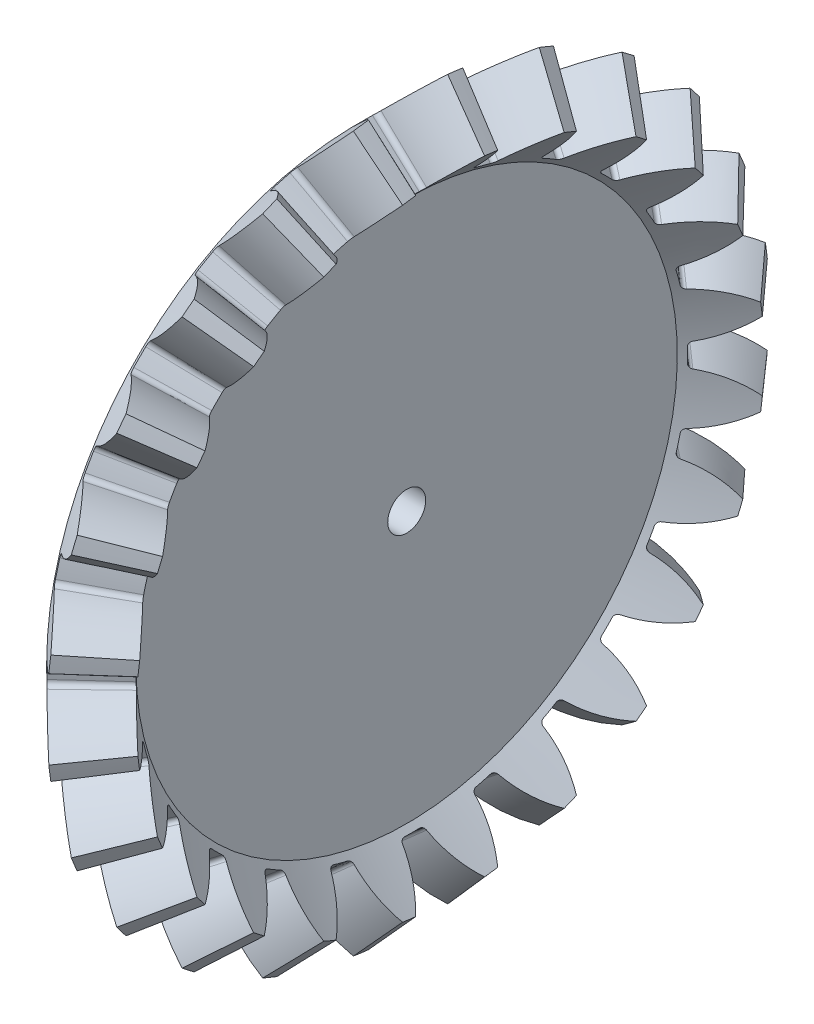
from build123d import *

# Parameters (mm, degrees)
TOOCUTSKE2_R    = 0.0127
TEETHCUTS_COUNT = 24
TEETHCUTS_ANGLE = 345
HUBSKE_R        = 5
HUB_DEPTH       = 0.0001016
BORSKE_R        = 1.5
BORE_DEPTH      = 29.363555216


with BuildPart() as part:
    # BasProSke → Base-Revolve (revolve)
    with BuildSketch(Plane(origin=(0, 0, 0), x_dir=(1, 0, 0), z_dir=(0, 1, 0))):
        Polygon((0, 0), (0, 24.636495586), (3.954494677, 28.590990256), (7.281695246, 24.847123014), (3.845024644, 21.410452418), (3.845024644, 0), align=None)
    revolve(axis=Axis((-10, 0, 0), (1, 0, 0)))

    # TooCutSke2 → ToothCut section 0
    with BuildSketch(Plane(origin=(14.681752183, -14.681752209, 0), x_dir=(0, 0, 1), z_dir=(-0.7071067805519597, 0.7071067818211354, 0))):
        with Locations((0, 20.763133078)):
            Circle(TOOCUTSKE2_R)
    # TooCutSke → ToothCut section 1
    with BuildSketch(Plane(origin=(1.977247339, 26.613742921, 0), x_dir=(0, 0, -1), z_dir=(-0.70710678055196, 0.7071067818211351, 0))):
        with BuildLine():
            ThreePointArc((-3.543432931, -3.170080071), (0, -3.38125), (3.543432931, -3.170080071))
            ThreePointArc((3.543432931, -3.170080071), (1.994806598, -0.846320605), (1.09374962, 1.796821067))
            ThreePointArc((1.09374962, 1.796821067), (0.94215301, 2.04478949), (0.666492312, 2.13688211))
            ThreePointArc((0.666492312, 2.13688211), (0, 2.12775), (-0.666492312, 2.13688211))
            ThreePointArc((-0.666492312, 2.13688211), (-0.94215301, 2.04478949), (-1.09374962, 1.796821067))
            ThreePointArc((-1.09374962, 1.796821067), (-1.994806598, -0.846320605), (-3.543432931, -3.170080071))
        make_face()
    toothcut = loft(mode=Mode.SUBTRACT)

    # TeethCuts: ToothCut ×24 about axis
    teethcuts_axis = Axis((-10, 0, 0), (1, 0, 0))
    for i in range(1, TEETHCUTS_COUNT):
        add(toothcut.rotate(teethcuts_axis, i * TEETHCUTS_ANGLE / (TEETHCUTS_COUNT - 1)), mode=Mode.SUBTRACT)

    # HubSke → Hub (add)
    with BuildSketch(Plane.ZY):
        Circle(HUBSKE_R)
    extrude(amount=HUB_DEPTH)

    # BorSke → Bore (cut, symmetric)
    with BuildSketch(Plane(origin=(0, 0, 0), x_dir=(0, 0, -1), z_dir=(1, 0, 0))):
        Circle(BORSKE_R)
    extrude(amount=BORE_DEPTH, both=True, mode=Mode.SUBTRACT)


solid = part.part
